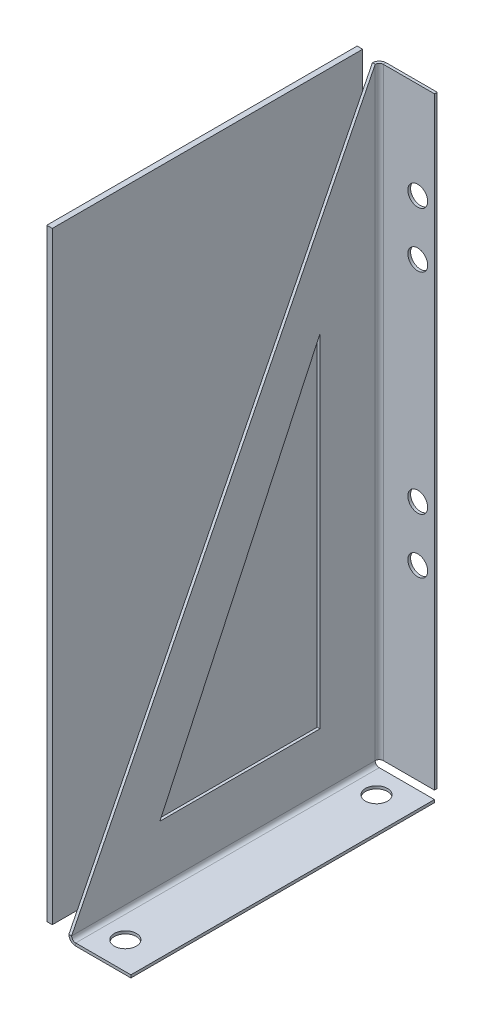
from build123d import *

# Parameters (mm, degrees)
SKETCH1_W           = 10
SKETCH1_H           = 55
BASE_FLANGE1_DEPTH  = 0.5
EDGE_FLANGE1_DEPTH  = 55
EDGE_FLANGE2_DEPTH  = 109.2634
SKETCH13_R          = 2
CUT_EXTRUDE1_DEPTH  = 1
CUT_EXTRUDE2_DEPTH  = 10
CUT_EXTRUDE7_DEPTH  = 10
BOSS_EXTRUDE1_START = 3
SKETCH16_W          = 56.2366
SKETCH16_H          = 109.2634
BOSS_EXTRUDE1_DEPTH = 1
SKETCH19_R          = 1.8
CUT_EXTRUDE4_DEPTH  = 10
SKETCH17_R          = 1.8
CUT_EXTRUDE5_DEPTH  = 10
SKETCH20_R          = 1.8
CUT_EXTRUDE6_DEPTH  = 10


# Sheet-metal steps are written as plain solids
with BuildPart() as part:
    # Sketch1 → Base-Flange1 (new body)
    with BuildSketch(Plane(origin=(0, 0, 0), x_dir=(1, 0, 0), z_dir=(0, 1, 0))):
        with Locations((-11.810772495, -5.547108859)):
            Rectangle(SKETCH1_W, SKETCH1_H)
    extrude(amount=-BASE_FLANGE1_DEPTH)

    # Edge-Flange1 section (across the edge) → Edge-Flange1 (add)
    with BuildSketch(Plane(origin=(-17.547372495, 0, -21.952891141), x_dir=(1, 0, 0), z_dir=(0, 0, 1))):
        with BuildLine():
            Line((-0.5, 0.7366), (-0.5, 110))
            Line((-0.5, 110), (0, 110))
            Line((0, 110), (0, 0.7366))
            ThreePointArc((0, 0.7366), (0.215745145, 0.215745145), (0.7366, 0))
            Line((0.7366, 0), (0.7366, -0.5))
            ThreePointArc((0.7366, -0.5), (-0.137808246, -0.137808246), (-0.5, 0.7366))
        make_face()
    extrude(amount=EDGE_FLANGE1_DEPTH)

    # Edge-Flange2 section (across the edge) → Edge-Flange2 (add)
    with BuildSketch(Plane(origin=(-17.547372495, 0.7366, -22.689491141), x_dir=(0, 0, 1), z_dir=(0, 1, 0))):
        with BuildLine():
            Line((-0.5, 0.7366), (-0.5, 10))
            Line((-0.5, 10), (0, 10))
            Line((0, 10), (0, 0.7366))
            ThreePointArc((0, 0.7366), (0.215745145, 0.215745145), (0.7366, 0))
            Line((0.7366, 0), (0.7366, -0.5))
            ThreePointArc((0.7366, -0.5), (-0.137808246, -0.137808246), (-0.5, 0.7366))
        make_face()
    extrude(amount=EDGE_FLANGE2_DEPTH)

    # Sketch13 → Cut-Extrude1 (cut)
    with BuildSketch(Plane(origin=(0, 0, 0), x_dir=(1, 0, 0), z_dir=(0, 1, 0))):
        with Locations(Location((-12.810772495, 17.452891141, 0), (0, 0, 270))):
            Circle(SKETCH13_R)
        with Locations(Location((-12.810772495, -28.047108859, 0), (0, 0, 270))):
            Circle(SKETCH13_R)
    extrude(amount=-CUT_EXTRUDE1_DEPTH, mode=Mode.SUBTRACT)

    # Sketch14 → Cut-Extrude2 (cut)
    with BuildSketch(Plane.ZY.offset(18.047372495)):
        Polygon((-21.952891141, 110), (33.047108859, 0.7366), (33.047108859, 110), align=None)
    extrude(amount=-CUT_EXTRUDE2_DEPTH, mode=Mode.SUBTRACT)

    # Sketch21 → Cut-Extrude7 (cut)
    with BuildSketch(Plane.ZY.offset(18.047372495)):
        Polygon((-11.952891141, 72.7366), (-11.952891141, 10.7366), (17.047108859, 10.7366), align=None)
    extrude(amount=-CUT_EXTRUDE7_DEPTH, mode=Mode.SUBTRACT)

    # Sketch19 → Cut-Extrude4 (cut)
    with BuildSketch(Plane.XY.offset(-22.689491141)):
        with Locations((-10.570772495, 34.4966)):
            Circle(SKETCH19_R)
    extrude(amount=-CUT_EXTRUDE4_DEPTH, mode=Mode.SUBTRACT)

    # Sketch17 → Cut-Extrude5 (cut)
    with BuildSketch(Plane.XY.offset(-22.689491141)):
        with Locations((-10.570772495, 44.4966)):
            Circle(SKETCH17_R)
    extrude(amount=-CUT_EXTRUDE5_DEPTH, mode=Mode.SUBTRACT)

    # Sketch20 → Cut-Extrude6 (cut)
    with BuildSketch(Plane.XY.offset(-22.689491141)):
        with Locations((-10.570772495, 82.4966)):
            Circle(SKETCH20_R)
        with Locations((-10.570772495, 92.4966)):
            Circle(SKETCH20_R)
    extrude(amount=-CUT_EXTRUDE6_DEPTH, mode=Mode.SUBTRACT)


with BuildPart() as body_2:
    # Sketch16 → Boss-Extrude1 (new body)
    with BuildSketch(Plane.ZY.offset(18.047372495).offset(BOSS_EXTRUDE1_START)):
        with Locations((4.928808859, 55.3683)):
            Rectangle(SKETCH16_W, SKETCH16_H)
    extrude(amount=BOSS_EXTRUDE1_DEPTH)


solid = Compound([part.part, body_2.part])
